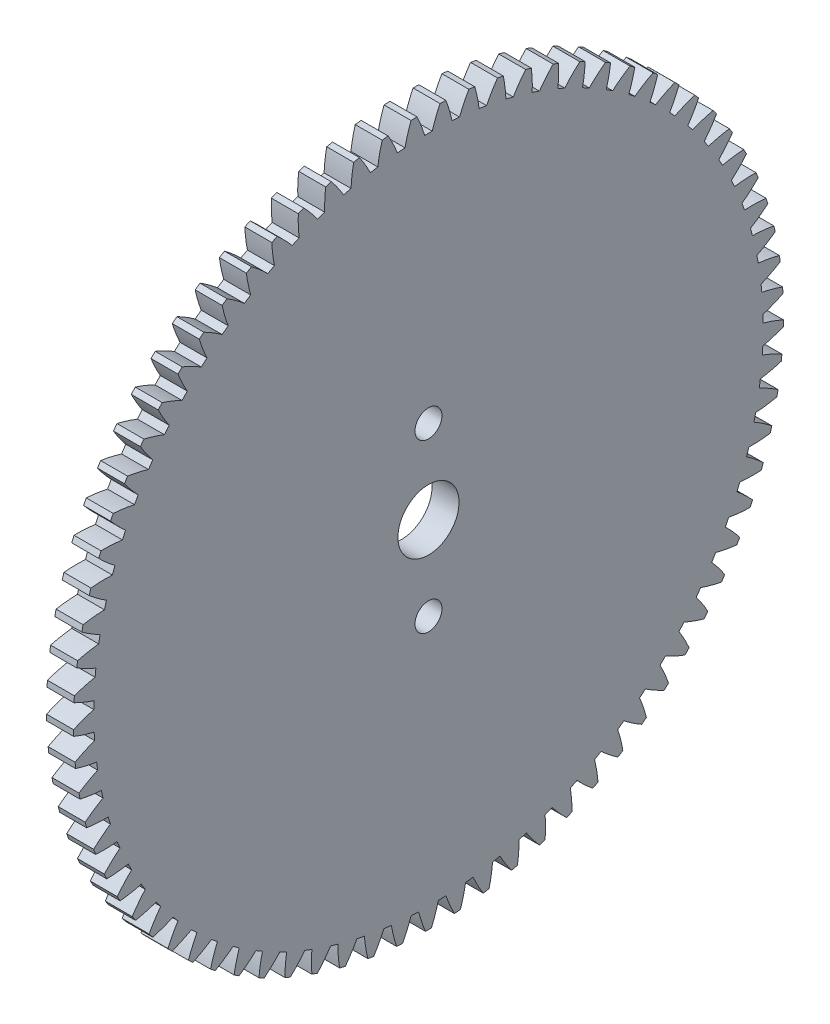
from build123d import *

# Parameters (mm, degrees)
BASPROSKE_W     = 2
BASPROSKE_H     = 39.5
TOOTHCUT_DEPTH  = 56.897227123
TEETHCUTS_COUNT = 77
TEETHCUTS_ANGLE = 355.324675325
BORSKE_R        = 3.4
BORSKE_R_2      = 1.5
BORE_DEPTH      = 50.0000508
SCALE1_SCALE_X  = 1.5
SCALE1_SCALE_Y  = 1
SCALE1_SCALE_Z  = 1


with BuildPart() as part:
    # BasProSke → Base-Revolve (revolve)
    with BuildSketch(Plane(origin=(0, 0, 0), x_dir=(1, 0, 0), z_dir=(0, 1, 0))):
        with Locations((1, 19.75)):
            Rectangle(BASPROSKE_W, BASPROSKE_H)
    revolve(axis=Axis((-10, 0, 0), (1, 0, 0)))

    # TooCutSke → ToothCut (cut, through all)
    with BuildSketch(Plane(origin=(0, 0, 0), x_dir=(0, 0, -1), z_dir=(1, 0, 0))):
        with BuildLine():
            ThreePointArc((0.421689506, 37.246612986), (0, 37.249), (-0.421689506, 37.246612986))
            ThreePointArc((-0.421689506, 37.246612986), (-0.813577504, 38.392577583), (-1.294307305, 39.504202482))
            ThreePointArc((-1.294307305, 39.504202482), (0, 39.5254), (1.294307305, 39.504202482))
            ThreePointArc((1.294307305, 39.504202482), (0.813577504, 38.392577583), (0.421689506, 37.246612986))
        make_face()
    toothcut = extrude(amount=TOOTHCUT_DEPTH, mode=Mode.SUBTRACT)

    # TeethCuts: ToothCut ×77 about axis
    teethcuts_axis = Axis((-10, 0, 0), (1, 0, 0))
    for i in range(1, TEETHCUTS_COUNT):
        add(toothcut.rotate(teethcuts_axis, i * TEETHCUTS_ANGLE / (TEETHCUTS_COUNT - 1)), mode=Mode.SUBTRACT)

    # BorSke → Bore (cut, symmetric)
    with BuildSketch(Plane(origin=(0, 0, 0), x_dir=(0, 0, -1), z_dir=(1, 0, 0))):
        Circle(BORSKE_R)
        with Locations((0, -9.3)):
            Circle(BORSKE_R_2)
        with Locations((0, 9.3)):
            Circle(BORSKE_R_2)
    extrude(amount=BORE_DEPTH, both=True, mode=Mode.SUBTRACT)


with BuildPart() as part_1:
    # Scale1: scaled about (1, 0, 0)
    add(part.part.scale((SCALE1_SCALE_X, SCALE1_SCALE_Y, SCALE1_SCALE_Z), about=(1, 0, 0)))


solid = part_1.part
